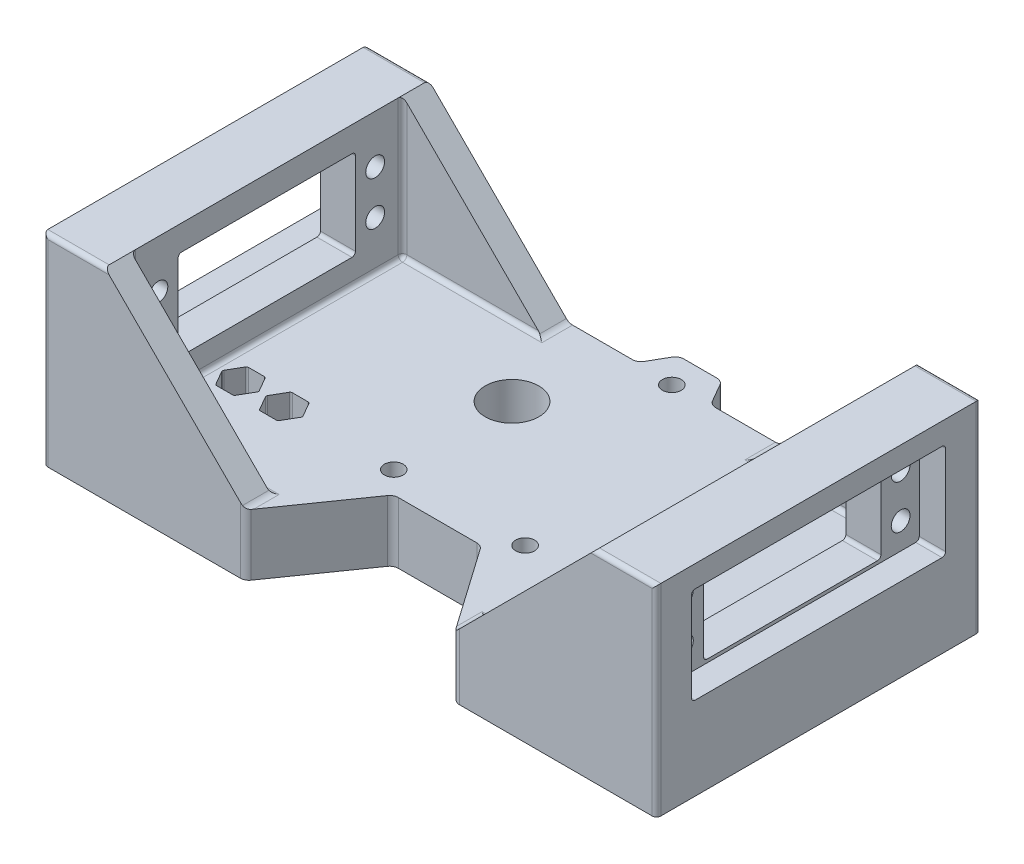
from build123d import *

# Parameters (mm, degrees)
SKETCH_1_W              = 120
SKETCH_1_H              = 44
SKETCH_1_R              = 2.15
EXTRUDE_1_DEPTH         = 8
MOVE_FACE_1_BY          = 10
EXTRUDE_START           = 6
SKETCH_3_W              = 120
SKETCH_3_H              = 54
SKETCH_3_W_2            = 56
SKETCH_3_H_2            = 22
EXTRUDE_2_DEPTH         = 6
SKETCH_4_R              = 2.15
CUT_EXTRUDE_2_DEPTH     = 92.942930669
SKETCH_6_R              = 2.15
EXTRUDE_3_DEPTH         = 14
SKETCH_6_3_R            = 2.15
CUT_EXTRUDE_6_DEPTH     = 92.942930669
FILLET_6_R              = 2
DELETE_START            = -6
DELETE_FACE_1_OUTLINE_W = 56
DELETE_FACE_1_OUTLINE_H = 22
DELETE_FACE_1_DEPTH     = 14
SKETCH_7_R              = 6.125
CUT_EXTRUDE_7_DEPTH     = 92.942930669
SKETCH_8_R              = 10
CUT_EXTRUDE_8_DEPTH     = 6
SKETCH_9_R              = 10
EXTRUDE_4_DEPTH         = 4
DELETE_START_2          = 2
DELETE_FACE_4_OUTLINE_R = 10
DELETE_FACE_4_DEPTH     = 6
MOVE_FACE_3_BY          = 10
MOVE_FACE_3_2_BY        = 10
SKETCH_11_R             = 2.15
SKETCH_11_W             = 40.5
SKETCH_11_H             = 20.5
EXTRUDE_5_DEPTH         = 14
SKETCH_11_6_W           = 58
SKETCH_11_6_H           = 22
SKETCH_11_6_R           = 2.15
SKETCH_11_6_W_2         = 40.5
SKETCH_11_6_H_2         = 20.5
CUT_EXTRUDE_10_DEPTH    = 6
SKETCH_12_R             = 2.15
CUT_EXTRUDE_11_DEPTH    = 113.971246342
CUT_EXTRUDE_12_DEPTH    = 6
FILLET_9_R              = 0.5
EXTRUDE_6_DEPTH         = 6
SKETCH_15_W             = 32
SKETCH_15_H             = 20
EXTRUDE_7_DEPTH         = 14
EXTRUDE_8_DEPTH         = 6
CHAMFER_3_SIZE          = 20
CHAMFER_3_SIZE_2        = 14.004150764
MIRROR_START            = 81.05
MIRROR_3_OUTLINE_W      = 22
MIRROR_3_OUTLINE_H      = 58
MIRROR_3_DEPTH          = 14
MIRROR_START_2          = 49.05
MIRROR_3_2_OUTLINE_W    = 14
MIRROR_3_2_OUTLINE_H    = 20
MIRROR_3_2_DEPTH        = 32
MIRROR_3_3_OUTLINE_W    = 22
MIRROR_3_3_OUTLINE_H    = 58
MIRROR_3_3_OUTLINE_R    = 2.15
MIRROR_3_3_OUTLINE_W_2  = 20.5
MIRROR_3_3_OUTLINE_H_2  = 40.5
MIRROR_3_3_DEPTH        = 8
MIRROR_START_3          = -22
MIRROR_3_4_DEPTH        = 6
MIRROR_START_4          = 46
MIRROR_3_5_DEPTH        = 6
CHAMFER_4_SIZE          = 14.004150764
CHAMFER_4_SIZE_2        = 20
FILLET_10_R             = 0.8
FILLET_11_R             = 2
FILLET_12_R             = 2
FILLET_13_R             = 1
FILLET_14_R             = 1
CUT_EXTRUDE_13_DEPTH    = 113.971246388
FILLET_15_R             = 2


with BuildPart() as part:
    # 草图1 → 凸台-拉伸1 (new body)
    with BuildSketch(Plane(origin=(0, 0, 0), x_dir=(1, 0, 0), z_dir=(0, 1, 0))):
        with Locations((25.05, 0)):
            Rectangle(SKETCH_1_W, SKETCH_1_H)
        with Locations(Location((-24.75, 5, 0), (0, 0, 270))):
            Circle(SKETCH_1_R, mode=Mode.SUBTRACT)
        with Locations(Location((-24.75, -5, 0), (0, 0, 270))):
            Circle(SKETCH_1_R, mode=Mode.SUBTRACT)
        with Locations(Location((24.75, -5, 0), (0, 0, 270))):
            Circle(SKETCH_1_R, mode=Mode.SUBTRACT)
        with Locations(Location((24.75, 5, 0), (0, 0, 270))):
            Circle(SKETCH_1_R, mode=Mode.SUBTRACT)
        with BuildLine():
            Line((19.75, -10.25), (-19.75, -10.25))
            ThreePointArc((-19.75, -10.25), (-20.103553391, -10.103553391), (-20.25, -9.75))
            Line((-20.25, -9.75), (-20.25, 9.75))
            ThreePointArc((-20.25, 9.75), (-20.103553391, 10.103553391), (-19.75, 10.25))
            Line((-19.75, 10.25), (19.75, 10.25))
            ThreePointArc((19.75, 10.25), (20.103553391, 10.103553391), (20.25, 9.75))
            Line((20.25, 9.75), (20.25, -9.75))
            ThreePointArc((20.25, -9.75), (20.103553391, -10.103553391), (19.75, -10.25))
        make_face(mode=Mode.SUBTRACT)
        with BuildLine():
            Line((42.994486373, 0.15), (41.652146997, 2.475))
            ThreePointArc((41.652146997, 2.475), (41.542339376, 2.584807621), (41.392339376, 2.625))
            Line((41.392339376, 2.625), (38.707660624, 2.625))
            ThreePointArc((38.707660624, 2.625), (38.557660624, 2.584807621), (38.447853003, 2.475))
            Line((38.447853003, 2.475), (37.105513627, 0.15))
            ThreePointArc((37.105513627, 0.15), (37.065321248, 0), (37.105513627, -0.15))
            Line((37.105513627, -0.15), (38.447853003, -2.475))
            ThreePointArc((38.447853003, -2.475), (38.557660624, -2.584807621), (38.707660624, -2.625))
            Line((38.707660624, -2.625), (41.392339376, -2.625))
            ThreePointArc((41.392339376, -2.625), (41.542339376, -2.584807621), (41.652146997, -2.475))
            Line((41.652146997, -2.475), (42.994486373, -0.15))
            ThreePointArc((42.994486373, -0.15), (43.034678752, 0), (42.994486373, 0.15))
        make_face(mode=Mode.SUBTRACT)
    extrude(amount=EXTRUDE_1_DEPTH)

    # Move Face 1: a face moved outward by 10.0
    extrude(part.faces().sort_by_distance((25.05, 4, 22))[0], amount=MOVE_FACE_1_BY, dir=(0, 0, 1))

    # 草图3 → 凸台-拉伸2 (add)
    with BuildSketch(Plane.XZ.offset(EXTRUDE_START)):
        with Locations((25.05, 5)):
            Rectangle(SKETCH_3_W, SKETCH_3_H)
        Rectangle(SKETCH_3_W_2, SKETCH_3_H_2, mode=Mode.SUBTRACT)
        with BuildLine():
            Line((41.652146997, 2.475), (42.994486373, 0.15))
            ThreePointArc((42.994486373, 0.15), (43.034678752, 0), (42.994486373, -0.15))
            Line((42.994486373, -0.15), (41.652146997, -2.475))
            ThreePointArc((41.652146997, -2.475), (41.542339376, -2.584807621), (41.392339376, -2.625))
            Line((41.392339376, -2.625), (38.707660624, -2.625))
            ThreePointArc((38.707660624, -2.625), (38.557660624, -2.584807621), (38.447853003, -2.475))
            Line((38.447853003, -2.475), (37.105513627, -0.15))
            ThreePointArc((37.105513627, -0.15), (37.065321248, 0), (37.105513627, 0.15))
            Line((37.105513627, 0.15), (38.447853003, 2.475))
            ThreePointArc((38.447853003, 2.475), (38.557660624, 2.584807621), (38.707660624, 2.625))
            Line((38.707660624, 2.625), (41.392339376, 2.625))
            ThreePointArc((41.392339376, 2.625), (41.542339376, 2.584807621), (41.652146997, 2.475))
        make_face(mode=Mode.SUBTRACT)
    extrude(amount=-EXTRUDE_2_DEPTH)

    # 草图4 → 切除-拉伸2 (cut, through all)
    with BuildSketch(Plane.XZ.offset(6)):
        with Locations(Location((-24.95, 27, 0), (0, 0, 270))):
            Circle(SKETCH_4_R)
        with Locations(Location((-14.95, 27, 0), (0, 0, 270))):
            Circle(SKETCH_4_R)
        with Locations(Location((65.05, 27, 0), (0, 0, 90))):
            Circle(SKETCH_4_R)
        with Locations(Location((75.05, 27, 0), (0, 0, 90))):
            Circle(SKETCH_4_R)
    extrude(amount=-CUT_EXTRUDE_2_DEPTH, mode=Mode.SUBTRACT)

    # 草图6 → 凸台-拉伸3 (add)
    with BuildSketch(Plane.XZ.offset(6)):
        Polygon((33.710254038, -21.5), (29.380127019, -14), (20.719872981, -14), (16.389745962, -21.5), (20.719872981, -29), (29.380127019, -29), align=None)
        with Locations((25.05, -21.5)):
            Circle(SKETCH_6_R, mode=Mode.SUBTRACT)
    extrude(amount=-EXTRUDE_3_DEPTH)

    # 草图6<3> → 切除-拉伸6 (cut, through all)
    with BuildSketch(Plane.XZ.offset(6)):
        with Locations(Location((25.05, -21.5, 0), (0, 0, 270))):
            Circle(SKETCH_6_3_R)
    extrude(amount=-CUT_EXTRUDE_6_DEPTH, mode=Mode.SUBTRACT)

    # 圆角6
    fillet_6_edges = [part.edges().sort_by_distance(p)[0] for p in [
        (20.719872981, 1, -29),
        (33.421578903, 1, -22),
        (29.380127019, 1, -29),
        (16.678421097, 1, -22),
    ]]
    fillet(fillet_6_edges, radius=FILLET_6_R)

    # Delete Face 1: read off the stored shape, not the designer's step
    # Delete Face 1 outline → Delete Face 1 (add)
    with BuildSketch(Plane(origin=(0, 0, 0), x_dir=(1, 0, 0), z_dir=(0, 1, 0)).offset(DELETE_START)):
        Rectangle(DELETE_FACE_1_OUTLINE_W, DELETE_FACE_1_OUTLINE_H)
    extrude(amount=DELETE_FACE_1_DEPTH)

    # 草图7 → 切除-拉伸7 (cut, through all)
    with BuildSketch(Plane.XZ.offset(6)):
        with Locations(Location((10.05, 0, 0), (0, 0, 270))):
            Circle(SKETCH_7_R)
    extrude(amount=-CUT_EXTRUDE_7_DEPTH, mode=Mode.SUBTRACT)

    # 草图8 → 切除-拉伸8 (cut)
    with BuildSketch(Plane(origin=(0, 8, 0), x_dir=(1, 0, 0), z_dir=(0, 1, 0))):
        with BuildLine():
            Line((34.576279442, 16), (30.534827557, 16))
            Line((30.534827557, 16), (29.380127019, 14))
            Line((29.380127019, 14), (20.719872981, 14))
            Line((20.719872981, 14), (19.565172443, 16))
            Line((19.565172443, 16), (15.523720558, 16))
            Line((15.523720558, 16), (-6.861582355, 16))
            ThreePointArc((-6.861582355, 16), (-11.823949745, 9.473359992), (-19.95, 10.563968614))
            ThreePointArc((-19.95, 10.563968614), (-24.349578485, 8.872147024), (-28.95, 9.899119773))
            Line((-28.95, 9.899119773), (-28.95, -19.899119773))
            ThreePointArc((-28.95, -19.899119773), (-24.349578485, -18.872147024), (-19.95, -20.563968614))
            ThreePointArc((-19.95, -20.563968614), (-11.823949745, -19.473359992), (-6.861582355, -26))
            Line((-6.861582355, -26), (56.961582355, -26))
            ThreePointArc((56.961582355, -26), (61.923949745, -19.473359992), (70.05, -20.563968614))
            ThreePointArc((70.05, -20.563968614), (74.449578485, -18.872147024), (79.05, -19.899119773))
            Line((79.05, -19.899119773), (79.05, 9.899119773))
            ThreePointArc((79.05, 9.899119773), (74.449578485, 8.872147024), (70.05, 10.563968614))
            ThreePointArc((70.05, 10.563968614), (61.923949745, 9.473359992), (56.961582355, 16))
            Line((56.961582355, 16), (34.576279442, 16))
        make_face()
        with Locations(Location((10.05, 0, 0), (0, 0, 270))):
            Circle(SKETCH_8_R, mode=Mode.SUBTRACT)
        with Locations(Location((40.05, 0, 0), (0, 0, 270))):
            Circle(SKETCH_8_R, mode=Mode.SUBTRACT)
    extrude(amount=-CUT_EXTRUDE_8_DEPTH, mode=Mode.SUBTRACT)

    # 草图9 → 凸台-拉伸4 (add)
    with BuildSketch(Plane(origin=(0, 8, 0), x_dir=(1, 0, 0), z_dir=(0, 1, 0))):
        with Locations(Location((40.05, 0, 0), (0, 0, 270))):
            Circle(SKETCH_9_R)
    extrude(amount=-EXTRUDE_4_DEPTH)

    # Delete Face 4: read off the stored shape, not the designer's step
    # Delete Face 4 outline → Delete Face 4 (add)
    with BuildSketch(Plane(origin=(0, 0, 0), x_dir=(1, 0, 0), z_dir=(0, 1, 0)).offset(DELETE_START_2)):
        with BuildLine():
            ThreePointArc((70.05, -20.563968614), (74.449578485, -18.872147024), (79.05, -19.899119773))
            Line((79.05, -19.899119773), (79.05, 9.899119773))
            ThreePointArc((79.05, 9.899119773), (74.449578485, 8.872147024), (70.05, 10.563968614))
            ThreePointArc((70.05, 10.563968614), (61.923949745, 9.473359992), (56.961582355, 16))
            Line((56.961582355, 16), (30.534827557, 16))
            Line((30.534827557, 16), (29.380127019, 14))
            Line((29.380127019, 14), (20.719872981, 14))
            Line((20.719872981, 14), (19.565172443, 16))
            Line((19.565172443, 16), (-6.861582355, 16))
            ThreePointArc((-6.861582355, 16), (-11.823949745, 9.473359992), (-19.95, 10.563968614))
            ThreePointArc((-19.95, 10.563968614), (-24.349578485, 8.872147024), (-28.95, 9.899119773))
            Line((-28.95, 9.899119773), (-28.95, -19.899119773))
            ThreePointArc((-28.95, -19.899119773), (-24.349578485, -18.872147024), (-19.95, -20.563968614))
            ThreePointArc((-19.95, -20.563968614), (-11.823949745, -19.473359992), (-6.861582355, -26))
            Line((-6.861582355, -26), (56.961582355, -26))
            ThreePointArc((56.961582355, -26), (61.923949745, -19.473359992), (70.05, -20.563968614))
        make_face()
        with Locations((10.05, 0)):
            Circle(DELETE_FACE_4_OUTLINE_R, mode=Mode.SUBTRACT)
        with Locations((40.05, 0)):
            Circle(DELETE_FACE_4_OUTLINE_R, mode=Mode.SUBTRACT)
    extrude(amount=DELETE_FACE_4_DEPTH)

    # Move Face 3: a face moved outward by 10.0
    extrude(part.faces().sort_by_distance((85.05, 1, 5))[0], amount=MOVE_FACE_3_BY, dir=(1, 0, 0))

    # Move Face 3 2: a face moved outward by 10.0
    extrude(part.faces().sort_by_distance((-34.95, 1, 5))[0], amount=MOVE_FACE_3_2_BY, dir=(-1, 0, 0))

    # 草图11 → 凸台-拉伸5 (add)
    with BuildSketch(Plane.ZY.offset(44.95)):
        Polygon((-22, 40), (-22, 8), (32, 8), (32, -6), (52, -6), (52, 40), align=None)
        with Locations((39.75, 19)):
            Circle(SKETCH_11_R, mode=Mode.SUBTRACT)
        with Locations((-9.75, 29)):
            Circle(SKETCH_11_R, mode=Mode.SUBTRACT)
        with Locations((15, 24)):
            Rectangle(SKETCH_11_W, SKETCH_11_H, mode=Mode.SUBTRACT)
        with Locations((39.75, 29)):
            Circle(SKETCH_11_R, mode=Mode.SUBTRACT)
        with Locations((-9.75, 19)):
            Circle(SKETCH_11_R, mode=Mode.SUBTRACT)
    extrude(amount=-EXTRUDE_5_DEPTH)

    # 草图11<6> → 切除-拉伸10 (cut)
    with BuildSketch(Plane.ZY.offset(44.95)):
        with Locations((15, 24)):
            Rectangle(SKETCH_11_6_W, SKETCH_11_6_H)
        with Locations((-9.75, 19)):
            Circle(SKETCH_11_6_R, mode=Mode.SUBTRACT)
        with Locations((39.75, 19)):
            Circle(SKETCH_11_6_R, mode=Mode.SUBTRACT)
        with Locations((39.75, 29)):
            Circle(SKETCH_11_6_R, mode=Mode.SUBTRACT)
        with Locations((-9.75, 29)):
            Circle(SKETCH_11_6_R, mode=Mode.SUBTRACT)
        with Locations((15, 24)):
            Rectangle(SKETCH_11_6_W_2, SKETCH_11_6_H_2, mode=Mode.SUBTRACT)
    extrude(amount=-CUT_EXTRUDE_10_DEPTH, mode=Mode.SUBTRACT)

    # 草图12 → 切除-拉伸11 (cut, through all)
    with BuildSketch(Plane(origin=(0, 8, 0), x_dir=(1, 0, 0), z_dir=(0, 1, 0))):
        with Locations(Location((10.05, -27, 0), (0, 0, 270))):
            Circle(SKETCH_12_R)
        with Locations(Location((40.05, -27, 0), (0, 0, 90))):
            Circle(SKETCH_12_R)
    extrude(amount=-CUT_EXTRUDE_11_DEPTH, mode=Mode.SUBTRACT)

    # 草图13 → 切除-拉伸12 (cut)
    with BuildSketch(Plane(origin=(0, 8, 0), x_dir=(1, 0, 0), z_dir=(0, 1, 0))):
        Polygon((-20.764210548, -27), (-22.857105274, -23.375), (-27.042894726, -23.375), (-29.135789452, -27), (-27.042894726, -30.625), (-22.857105274, -30.625), align=None)
        Polygon((-10.764210548, -27), (-12.857105274, -23.375), (-17.042894726, -23.375), (-19.135789452, -27), (-17.042894726, -30.625), (-12.857105274, -30.625), align=None)
        Polygon((62.957105274, -30.625), (60.864210548, -27), (62.957105274, -23.375), (67.142894726, -23.375), (69.235789452, -27), (67.142894726, -30.625), align=None)
        Polygon((72.957105274, -30.625), (70.864210548, -27), (72.957105274, -23.375), (77.142894726, -23.375), (79.235789452, -27), (77.142894726, -30.625), align=None)
    extrude(amount=-CUT_EXTRUDE_12_DEPTH, mode=Mode.SUBTRACT)

    # 圆角9
    fillet_9_edges = [part.edges().sort_by_distance(p)[0] for p in [
        (-20.764210548, 5, 27),
        (-22.857105274, 5, 30.625),
        (-27.042894726, 5, 30.625),
        (-29.135789452, 5, 27),
        (-27.042894726, 5, 23.375),
        (-22.857105274, 5, 23.375),
        (-10.764210548, 5, 27),
        (-12.857105274, 5, 30.625),
        (-17.042894726, 5, 30.625),
        (-19.135789452, 5, 27),
        (-17.042894726, 5, 23.375),
        (-12.857105274, 5, 23.375),
        (67.142894726, 5, 30.625),
        (62.957105274, 5, 30.625),
        (60.864210548, 5, 27),
        (62.957105274, 5, 23.375),
        (67.142894726, 5, 23.375),
        (69.235789452, 5, 27),
        (77.142894726, 5, 30.625),
        (72.957105274, 5, 30.625),
        (70.864210548, 5, 27),
        (72.957105274, 5, 23.375),
        (77.142894726, 5, 23.375),
        (79.235789452, 5, 27),
    ]]
    fillet(fillet_9_edges, radius=FILLET_9_R)

    # 草图14 → 凸台-拉伸6 (add)
    with BuildSketch(Plane(origin=(0, 0, -22), x_dir=(-1, 0, 0), z_dir=(0, 0, -1))):
        Polygon((30.95, 40), (-1.05, 8), (30.95, 8), align=None)
    extrude(amount=-EXTRUDE_6_DEPTH)

    # 草图15 → 凸台-拉伸7 (add)
    with BuildSketch(Plane(origin=(0, 8, 0), x_dir=(1, 0, 0), z_dir=(0, 1, 0))):
        with Locations((-14.95, -42)):
            Rectangle(SKETCH_15_W, SKETCH_15_H)
    extrude(amount=-EXTRUDE_7_DEPTH)

    # 草图16 → 凸台-拉伸8 (add)
    with BuildSketch(Plane.XY.offset(52)):
        Polygon((-30.95, 40), (-30.95, 8), (1.05, 8), align=None)
    extrude(amount=-EXTRUDE_8_DEPTH)

    # 倒角3
    # the kernel refuses this chamfer: 20, 14.004150764 mm, written as the material it adds along each edge
    with BuildSketch(Plane(origin=(1.05, 8, 32), x_dir=(0, 0, 1), z_dir=(0, -1, 0))) as chamfer_3_piece_1_section:
        Polygon((CHAMFER_3_SIZE, 0), (0, -CHAMFER_3_SIZE_2), (0, 0), align=None)
    chamfer_3_piece_1 = extrude(amount=14, mode=Mode.PRIVATE)
    chamfer_3_piece_1 = split(chamfer_3_piece_1, bisect_by=Plane(origin=(1.05, 8, 52), z_dir=(0, 0, -1)), keep=Keep.TOP, mode=Mode.PRIVATE)
    add(chamfer_3_piece_1)

    # 镜向3: read off the stored shape, not the designer's step
    # 镜向3 outline → 镜向3 (add)
    with BuildSketch(Plane.YZ.offset(MIRROR_START)):
        Polygon((40, -22), (40, 52), (-6, 52), (-6, 32), (8, 32), (8, -22), align=None)
        with Locations((24, 15)):
            Rectangle(MIRROR_3_OUTLINE_W, MIRROR_3_OUTLINE_H, mode=Mode.SUBTRACT)
    extrude(amount=MIRROR_3_DEPTH)

    # Mirror 3 2 outline → Mirror 3 2 (add)
    with BuildSketch(Plane.YZ.offset(MIRROR_START_2)):
        with Locations((1, 42)):
            Rectangle(MIRROR_3_2_OUTLINE_W, MIRROR_3_2_OUTLINE_H)
    extrude(amount=MIRROR_3_2_DEPTH)

    # Mirror 3 3 outline → Mirror 3 3 (add)
    with BuildSketch(Plane.YZ.offset(MIRROR_START)):
        with Locations((24, 15)):
            Rectangle(MIRROR_3_3_OUTLINE_W, MIRROR_3_3_OUTLINE_H)
        with Locations((19, -9.75)):
            Circle(MIRROR_3_3_OUTLINE_R, mode=Mode.SUBTRACT)
        with Locations((29, -9.75)):
            Circle(MIRROR_3_3_OUTLINE_R, mode=Mode.SUBTRACT)
        with Locations((24, 15)):
            Rectangle(MIRROR_3_3_OUTLINE_W_2, MIRROR_3_3_OUTLINE_H_2, mode=Mode.SUBTRACT)
        with Locations((19, 39.75)):
            Circle(MIRROR_3_3_OUTLINE_R, mode=Mode.SUBTRACT)
        with Locations((29, 39.75)):
            Circle(MIRROR_3_3_OUTLINE_R, mode=Mode.SUBTRACT)
    extrude(amount=MIRROR_3_3_DEPTH)

    # Mirror 3 4 outline → Mirror 3 4 (add)
    with BuildSketch(Plane.XY.offset(MIRROR_START_3)):
        Polygon((81.05, 40), (49.05, 8), (81.05, 8), align=None)
    extrude(amount=MIRROR_3_4_DEPTH)

    # Mirror 3 5 outline → Mirror 3 5 (add)
    with BuildSketch(Plane.XY.offset(MIRROR_START_4)):
        Polygon((81.05, 40), (49.05, 8), (81.05, 8), align=None)
    extrude(amount=MIRROR_3_5_DEPTH)

    # 倒角4
    # the kernel refuses this chamfer: 20, 14.004150764 mm, written as the material it adds along each edge
    with BuildSketch(Plane(origin=(49.05, -6, 32), x_dir=(-1, 0, 0), z_dir=(0, 1, 0))) as chamfer_4_piece_1_section:
        Polygon((CHAMFER_4_SIZE, 0), (0, CHAMFER_4_SIZE_2), (0, 0), align=None)
    chamfer_4_piece_1 = extrude(amount=14, mode=Mode.PRIVATE)
    chamfer_4_piece_1 = split(chamfer_4_piece_1, bisect_by=Plane(origin=(42.05, 1, 32), z_dir=(0.7071067811865476, -0.7071067811865476, 0)), keep=Keep.TOP, mode=Mode.PRIVATE)
    chamfer_4_piece_1 = split(chamfer_4_piece_1, bisect_by=Plane(origin=(49.05, -6, 52), z_dir=(0, 0, -1)), keep=Keep.TOP, mode=Mode.PRIVATE)
    add(chamfer_4_piece_1)
    with BuildSketch(Plane(origin=(49.05, -6, 32), x_dir=(-1, 0, 0), z_dir=(0, 1, 0))) as chamfer_4_piece_2_section:
        Polygon((CHAMFER_4_SIZE, 0), (0, CHAMFER_4_SIZE_2), (0, 0), align=None)
    chamfer_4_piece_2 = extrude(amount=14, mode=Mode.PRIVATE)
    chamfer_4_piece_2 = split(chamfer_4_piece_2, bisect_by=Plane(origin=(42.05, 1, 32), z_dir=(-0.7071067811865476, 0.7071067811865476, 0)), keep=Keep.TOP, mode=Mode.PRIVATE)
    add(chamfer_4_piece_2)

    # 圆角10
    fillet_10_edges = [part.edges().sort_by_distance(p)[0] for p in [
        (-34.95, 13.75, -5.25),
        (-34.95, 13.75, 35.25),
        (-34.95, 34.25, 35.25),
        (-34.95, 34.25, -5.25),
        (-41.95, 13, 44),
        (-41.95, 13, -14),
        (-41.95, 35, -14),
        (-41.95, 35, 44),
        (85.05, 13.75, 35.25),
        (85.05, 13.75, -5.25),
        (85.05, 34.25, -5.25),
        (85.05, 34.25, 35.25),
        (92.05, 13, -14),
        (92.05, 13, 44),
        (92.05, 35, 44),
        (92.05, 35, -14),
    ]]
    fillet(fillet_10_edges, radius=FILLET_10_R)

    # 圆角11
    fillet_11_edges = [part.edges().sort_by_distance(p)[0] for p in [
        (1.05, 1, 52),
        (15.054150764, 1, 32),
        (49.05, 1, 52),
        (35.045849236, 1, 32),
    ]]
    fillet(fillet_11_edges, radius=FILLET_11_R)

    # 圆角12
    fillet_12_edges = [part.edges().sort_by_distance(p)[0] for p in [
        (1.05, 8, -19),
        (49.05, 8, -19),
        (49.05, 8, 48.853820793),
        (1.05, 8, 48.853820793),
    ]]
    fillet(fillet_12_edges, radius=FILLET_12_R)

    # 圆角13
    fillet_13_edges = [part.edges().sort_by_distance(p)[0] for p in [
        (64.635786438, 8, 46),
        (81.05, 8, 15),
        (81.05, 24, 46),
        (81.05, 24, -16),
        (64.635786438, 8, -16),
        (-14.535786438, 8, 46),
        (-30.95, 8, 15),
        (-30.95, 24, 46),
        (-30.95, 24, -16),
        (-14.535786438, 8, -16),
    ]]
    fillet(fillet_13_edges, radius=FILLET_13_R)

    # 圆角14
    fillet_14_edges = [part.edges().sort_by_distance(p)[0] for p in [
        (-37.95, 40, -22),
        (-37.95, 40, 52),
        (-44.95, 17, 52),
        (95.05, 17, 52),
        (88.05, 40, 52),
        (88.05, 40, -22),
        (-44.95, 17, -22),
        (95.05, 17, -22),
    ]]
    fillet(fillet_14_edges, radius=FILLET_14_R)

    # 草图17 → 切除-拉伸13 (cut, through all)
    with BuildSketch(Plane(origin=(0, 8, 0), x_dir=(1, 0, 0), z_dir=(0, 1, 0))):
        with BuildLine():
            Line((20.142522712, 28), (29.957477288, 28))
            ThreePointArc((29.957477288, 28), (29.225426481, 28.732050808), (28.225426481, 29))
            Line((28.225426481, 29), (21.874573519, 29))
            ThreePointArc((21.874573519, 29), (20.874573519, 28.732050808), (20.142522712, 28))
        make_face()
    extrude(amount=-CUT_EXTRUDE_13_DEPTH, mode=Mode.SUBTRACT)

    # 圆角15
    fillet_15_edges = [part.edges().sort_by_distance(p)[0] for p in [
        (20.142522712, 1, -28),
        (29.957477288, 1, -28),
    ]]
    fillet(fillet_15_edges, radius=FILLET_15_R)


solid = part.part
